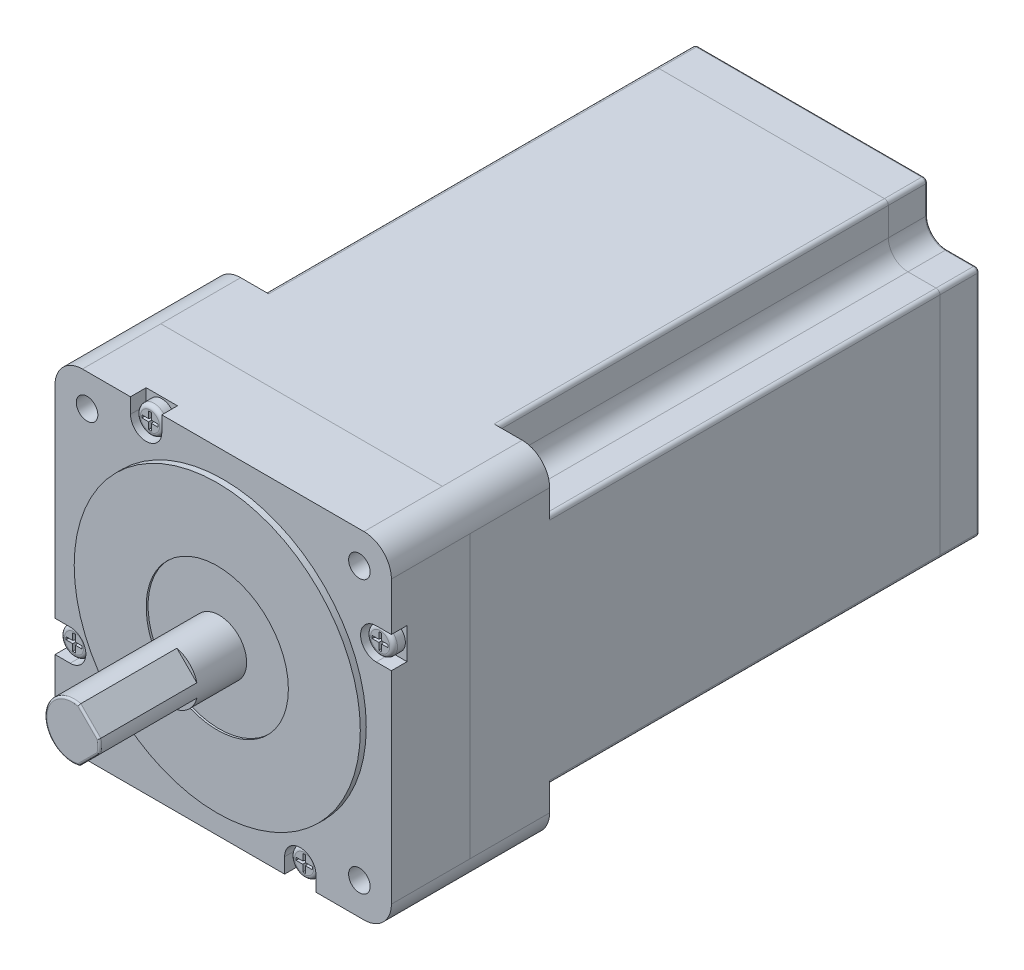
from build123d import *
from OCP.BRepFilletAPI import BRepFilletAPI_MakeChamfer

# Parameters (mm, degrees)
SKETCH1_R                = 2.75
BOSS_EXTRUDE1_DEPTH      = 150
SKETCH2_R                = 36.51
BOSS_EXTRUDE2_DEPTH      = 1.52
BOSS_EXTRUDE3_DEPTH      = 37
BOSS_EXTRUDE3_DEPTH_BACK = 1
SKETCH3_R                = 7
CUT_EXTRUDE1_DEPTH       = 25
FILLET1_R                = 0.5
SKETCH5_R                = 18.150459798
CUT_EXTRUDE2_DEPTH       = 0.5
CUT_EXTRUDE3_DEPTH       = 109.62
FILLET2_R                = 0.5
FILLET3_R                = 1
SKETCH8_R                = 10
CUT_EXTRUDE4_DEPTH       = 1
SKETCH9_R                = 6
BOSS_EXTRUDE4_DEPTH      = 0.8
CUT_EXTRUDE5_DEPTH       = 4
SKETCH11_R               = 3.434192677
BOSS_EXTRUDE5_DEPTH      = 3
FILLET4_R                = 1
CUT_EXTRUDE6_DEPTH       = 2
CUT_EXTRUDE6_DRAFT       = -6
CHAMFER2_SIZE            = 1.5
CHAMFER2_SIZE2           = 1.685405696
CIRPATTERN3_COUNT        = 4


with BuildPart() as part:
    # Sketch1 → Boss-Extrude1 (new body)
    with BuildSketch(Plane.XY):
        with BuildLine():
            Line((-35.925, -42.925), (35.925, -42.925))
            ThreePointArc((35.925, -42.925), (40.874747468, -40.874747468), (42.925, -35.925))
            Line((42.925, -35.925), (42.925, 35.925))
            ThreePointArc((42.925, 35.925), (40.874747468, 40.874747468), (35.925, 42.925))
            Line((35.925, 42.925), (-35.925, 42.925))
            ThreePointArc((-35.925, 42.925), (-40.874747468, 40.874747468), (-42.925, 35.925))
            Line((-42.925, 35.925), (-42.925, -35.925))
            ThreePointArc((-42.925, -35.925), (-40.874747468, -40.874747468), (-35.925, -42.925))
        make_face()
        with Locations((-34.75, 34.75)):
            Circle(SKETCH1_R, mode=Mode.SUBTRACT)
        with Locations((34.75, 34.75)):
            Circle(SKETCH1_R, mode=Mode.SUBTRACT)
        with Locations((-34.75, -34.75)):
            Circle(SKETCH1_R, mode=Mode.SUBTRACT)
        with Locations((34.75, -34.75)):
            Circle(SKETCH1_R, mode=Mode.SUBTRACT)
    extrude(amount=BOSS_EXTRUDE1_DEPTH)

    # Sketch2 → Boss-Extrude2 (add)
    with BuildSketch(Plane.XY.offset(150)):
        Circle(SKETCH2_R)
    extrude(amount=BOSS_EXTRUDE2_DEPTH)

    # Sketch5 → Cut-Extrude2 (cut)
    with BuildSketch(Plane.XY.offset(151.52)):
        Circle(SKETCH5_R)
    extrude(amount=-CUT_EXTRUDE2_DEPTH, mode=Mode.SUBTRACT)

    # Sketch6 → Cut-Extrude3 (cut)
    with BuildSketch(Plane(origin=(0, 0, 0), x_dir=(-1, 0, 0), z_dir=(0, 0, -1))):
        with BuildLine():
            Line((-29.75, 34.75), (-29.75, 42.925))
            Line((-29.75, 42.925), (-35.925, 42.925))
            ThreePointArc((-35.925, 42.925), (-40.874747468, 40.874747468), (-42.925, 35.925))
            Line((-42.925, 35.925), (-42.925, 29.75))
            Line((-42.925, 29.75), (-34.75, 29.75))
            ThreePointArc((-34.75, 29.75), (-31.214466094, 31.214466094), (-29.75, 34.75))
        make_face()
        with BuildLine():
            Line((35.925, 42.925), (29.75, 42.925))
            Line((29.75, 42.925), (29.75, 34.75))
            ThreePointArc((29.75, 34.75), (31.214466094, 31.214466094), (34.75, 29.75))
            Line((34.75, 29.75), (42.925, 29.75))
            Line((42.925, 29.75), (42.925, 35.925))
            ThreePointArc((42.925, 35.925), (40.874747468, 40.874747468), (35.925, 42.925))
        make_face()
        with BuildLine():
            Line((29.75, -34.75), (29.75, -42.925))
            Line((29.75, -42.925), (35.925, -42.925))
            ThreePointArc((35.925, -42.925), (40.874747468, -40.874747468), (42.925, -35.925))
            Line((42.925, -35.925), (42.925, -29.75))
            Line((42.925, -29.75), (34.75, -29.75))
            ThreePointArc((34.75, -29.75), (31.214466094, -31.214466094), (29.75, -34.75))
        make_face()
        with BuildLine():
            Line((-35.925, -42.925), (-29.75, -42.925))
            Line((-29.75, -42.925), (-29.75, -34.75))
            ThreePointArc((-29.75, -34.75), (-31.214466094, -31.214466094), (-34.75, -29.75))
            Line((-34.75, -29.75), (-42.925, -29.75))
            Line((-42.925, -29.75), (-42.925, -35.925))
            ThreePointArc((-42.925, -35.925), (-40.874747468, -40.874747468), (-35.925, -42.925))
        make_face()
    extrude(amount=-CUT_EXTRUDE3_DEPTH, mode=Mode.SUBTRACT)

    # Fillet2
    fillet2_edges = [part.edges().sort_by_distance(p)[0] for p in [
        (42.925, 0, 0),
        (29.75, -38.8375, 0),
        (31.214466094, -31.214466094, 0),
        (38.8375, -29.75, 0),
        (0, 42.925, 0),
        (31.214466094, 31.214466094, 0),
        (29.75, 38.8375, 0),
        (38.8375, 29.75, 0),
        (-42.925, 0, 0),
        (-29.75, 38.8375, 0),
        (-31.214466094, 31.214466094, 0),
        (-38.8375, 29.75, 0),
        (0, -42.925, 0),
        (-31.214466094, -31.214466094, 0),
        (-29.75, -38.8375, 0),
        (-38.8375, -29.75, 0),
    ]]
    fillet(fillet2_edges, radius=FILLET2_R)

    # Fillet3
    # the kernel refuses this fillet: 1 mm, written as the material it takes off along each edge
    with BuildSketch(Plane(origin=(-41.925, -28.75, 0), x_dir=(0, -1, 0), z_dir=(1, 0, 0))) as fillet3_piece_1:
        with BuildLine():
            CenterArc((0.5, -0.5), 0.5, 0, 90)
            Line((1, -0.5), (1, 0))
            Line((1, 0), (0.5, 0))
        make_face()
    revolve(axis=Axis((-41.925, -28.75, 0), (0, 0, -1)), revolution_arc=90, mode=Mode.SUBTRACT)
    with BuildSketch(Plane(origin=(-41.925, 28.75, 0), x_dir=(-1, 0, 0), z_dir=(0, -1, 0))) as fillet3_piece_2:
        with BuildLine():
            CenterArc((0.5, -0.5), 0.5, 0, 90)
            Line((1, -0.5), (1, 0))
            Line((1, 0), (0.5, 0))
        make_face()
    revolve(axis=Axis((-41.925, 28.75, 0), (0, 0, -1)), revolution_arc=90, mode=Mode.SUBTRACT)
    with BuildSketch(Plane(origin=(-28.75, -41.925, 0), x_dir=(0, -1, 0), z_dir=(1, 0, 0))) as fillet3_piece_3:
        with BuildLine():
            CenterArc((0.5, -0.5), 0.5, 0, 90)
            Line((1, -0.5), (1, 0))
            Line((1, 0), (0.5, 0))
        make_face()
    revolve(axis=Axis((-28.75, -41.925, 0), (0, 0, -1)), revolution_arc=90, mode=Mode.SUBTRACT)
    with BuildSketch(Plane(origin=(28.75, -41.925, 0), x_dir=(1, 0, 0), z_dir=(0, 1, 0))) as fillet3_piece_4:
        with BuildLine():
            CenterArc((0.5, -0.5), 0.5, 0, 90)
            Line((1, -0.5), (1, 0))
            Line((1, 0), (0.5, 0))
        make_face()
    revolve(axis=Axis((28.75, -41.925, 0), (0, 0, -1)), revolution_arc=90, mode=Mode.SUBTRACT)
    with BuildSketch(Plane(origin=(-28.75, 41.925, 0), x_dir=(-1, 0, 0), z_dir=(0, -1, 0))) as fillet3_piece_5:
        with BuildLine():
            CenterArc((0.5, -0.5), 0.5, 0, 90)
            Line((1, -0.5), (1, 0))
            Line((1, 0), (0.5, 0))
        make_face()
    revolve(axis=Axis((-28.75, 41.925, 0), (0, 0, -1)), revolution_arc=90, mode=Mode.SUBTRACT)
    with BuildSketch(Plane(origin=(28.75, 41.925, 0), x_dir=(0, 1, 0), z_dir=(-1, 0, 0))) as fillet3_piece_6:
        with BuildLine():
            CenterArc((0.5, -0.5), 0.5, 0, 90)
            Line((1, -0.5), (1, 0))
            Line((1, 0), (0.5, 0))
        make_face()
    revolve(axis=Axis((28.75, 41.925, 0), (0, 0, -1)), revolution_arc=90, mode=Mode.SUBTRACT)
    with BuildSketch(Plane(origin=(41.925, -28.75, 0), x_dir=(1, 0, 0), z_dir=(0, 1, 0))) as fillet3_piece_7:
        with BuildLine():
            CenterArc((0.5, -0.5), 0.5, 0, 90)
            Line((1, -0.5), (1, 0))
            Line((1, 0), (0.5, 0))
        make_face()
    revolve(axis=Axis((41.925, -28.75, 0), (0, 0, -1)), revolution_arc=90, mode=Mode.SUBTRACT)
    with BuildSketch(Plane(origin=(41.925, 28.75, 0), x_dir=(0, 1, 0), z_dir=(-1, 0, 0))) as fillet3_piece_8:
        with BuildLine():
            CenterArc((0.5, -0.5), 0.5, 0, 90)
            Line((1, -0.5), (1, 0))
            Line((1, 0), (0.5, 0))
        make_face()
    revolve(axis=Axis((41.925, 28.75, 0), (0, 0, -1)), revolution_arc=90, mode=Mode.SUBTRACT)
    with BuildSketch(Plane(origin=(42.925, -29.75, 0), x_dir=(0, 1, 0), z_dir=(0, 0, 1)), Plane(origin=(-29.75, -42.925, 0), x_dir=(1, 0, 0), z_dir=(0, 0, 1)), Plane(origin=(-42.925, -29.75, 0), x_dir=(1, 0, 0), z_dir=(0, 0, 1)), Plane(origin=(-42.925, 29.75, 0), x_dir=(0, -1, 0), z_dir=(0, 0, 1)), Plane(origin=(29.75, 42.925, 0), x_dir=(-1, 0, 0), z_dir=(0, 0, 1))) as fillet3_piece_9:
        with BuildLine():
            CenterArc((FILLET3_R, FILLET3_R), FILLET3_R, 180, 90)
            Line((0, FILLET3_R), (0, 0))
            Line((0, 0), (FILLET3_R, 0))
        make_face()
    extrude(amount=109.62, mode=Mode.SUBTRACT)
    with BuildSketch(Plane(origin=(29.75, -42.925, 0), x_dir=(-1, 0, 0), z_dir=(0, 0, 1)), Plane(origin=(-29.75, 42.925, 0), x_dir=(1, 0, 0), z_dir=(0, 0, 1)), Plane(origin=(42.925, 29.75, 0), x_dir=(0, -1, 0), z_dir=(0, 0, 1))) as fillet3_piece_10:
        with BuildLine():
            CenterArc((FILLET3_R, -FILLET3_R), FILLET3_R, 90, 90)
            Line((0, -FILLET3_R), (0, 0))
            Line((0, 0), (FILLET3_R, 0))
        make_face()
    extrude(amount=109.62, mode=Mode.SUBTRACT)

    # Sketch8 → Cut-Extrude4 (cut)
    with BuildSketch(Plane(origin=(0, 0, 0), x_dir=(-1, 0, 0), z_dir=(0, 0, -1))):
        Circle(SKETCH8_R)
    extrude(amount=-CUT_EXTRUDE4_DEPTH, mode=Mode.SUBTRACT)

    # Sketch10 → Cut-Extrude5 (cut)
    with BuildSketch(Plane.XY.offset(150)):
        with BuildLine():
            Line((-23.668230311, 39.056860772), (-23.668230311, 42.925))
            Line((-23.668230311, 42.925), (-15.668230311, 42.925))
            Line((-15.668230311, 42.925), (-15.668230311, 39.056860772))
            ThreePointArc((-15.668230311, 39.056860772), (-19.668230311, 35.056860772), (-23.668230311, 39.056860772))
        make_face()
        with BuildLine():
            Line((39.056860772, 23.668230311), (42.925, 23.668230311))
            Line((42.925, 23.668230311), (42.925, 15.668230311))
            Line((42.925, 15.668230311), (39.056860772, 15.668230311))
            ThreePointArc((39.056860772, 15.668230311), (35.056860772, 19.668230311), (39.056860772, 23.668230311))
        make_face()
        with BuildLine():
            Line((23.668230311, -39.056860772), (23.668230311, -42.925))
            Line((23.668230311, -42.925), (15.668230311, -42.925))
            Line((15.668230311, -42.925), (15.668230311, -39.056860772))
            ThreePointArc((15.668230311, -39.056860772), (19.668230311, -35.056860772), (23.668230311, -39.056860772))
        make_face()
        with BuildLine():
            Line((-39.056860772, -23.668230311), (-42.925, -23.668230311))
            Line((-42.925, -23.668230311), (-42.925, -15.668230311))
            Line((-42.925, -15.668230311), (-39.056860772, -15.668230311))
            ThreePointArc((-39.056860772, -15.668230311), (-35.056860772, -19.668230311), (-39.056860772, -23.668230311))
        make_face()
    extrude(amount=-CUT_EXTRUDE5_DEPTH, mode=Mode.SUBTRACT)


with BuildPart() as body_2:
    # Sketch3 → Boss-Extrude3 (new, two sides: drawn at the far end of the back side and taken through both)
    with BuildSketch(Plane.XY.offset(151.52).offset(-BOSS_EXTRUDE3_DEPTH_BACK)):
        Circle(SKETCH3_R)
    extrude(amount=BOSS_EXTRUDE3_DEPTH + BOSS_EXTRUDE3_DEPTH_BACK)

    # Sketch4 → Cut-Extrude1 (cut)
    with BuildSketch(Plane.XY.offset(188.52)):
        with BuildLine():
            Line((1.69313093, 6.792150444), (6.792150444, 1.69313093))
            ThreePointArc((6.792150444, 1.69313093), (4.949747468, 4.949747468), (1.69313093, 6.792150444))
        make_face()
        with BuildLine():
            Line((1.69313093, -6.792150444), (6.792150444, -1.69313093))
            ThreePointArc((6.792150444, -1.69313093), (4.949747468, -4.949747468), (1.69313093, -6.792150444))
        make_face()
    extrude(amount=-CUT_EXTRUDE1_DEPTH, mode=Mode.SUBTRACT)

    # Fillet1
    fillet1_edges = [body_2.edges().sort_by_distance(p)[0] for p in [
        (4.242640687, 4.242640687, 188.52),
        (6.947843302, 0.852920539, 188.52),
        (4.242640687, -4.242640687, 188.52),
        (-7, 0, 188.52),
    ]]
    fillet(fillet1_edges, radius=FILLET1_R)


with BuildPart() as body_3:
    # Sketch9 → Boss-Extrude4 (new body)
    with BuildSketch(Plane(origin=(0, 0, 1), x_dir=(-1, 0, 0), z_dir=(0, 0, -1))):
        Circle(SKETCH9_R)
    extrude(amount=BOSS_EXTRUDE4_DEPTH)


with BuildPart() as body_4:
    # Sketch11 → Boss-Extrude5 (new body)
    with BuildSketch(Plane.XY.offset(146)):
        with Locations((-19.668230311, 39.056860772)):
            Circle(SKETCH11_R)
    extrude(amount=BOSS_EXTRUDE5_DEPTH)

    # Fillet4
    fillet4_edges = [body_4.edges().sort_by_distance(p)[0] for p in [
        (-23.102422989, 39.056860772, 149),
    ]]
    fillet(fillet4_edges, radius=FILLET4_R)


with BuildPart() as cut_extrude6_tool:
    # Sketch12 → Cut-Extrude6 (with draft: the straight prism first)
    with BuildSketch(Plane.XY.offset(149)):
        Polygon((-19.317907501, 39.406818019), (-19.317907501, 41.116130582), (-20.018553122, 41.116130582), (-20.018553122, 39.406818019), (-21.725351266, 39.406818019), (-21.725351266, 38.706903524), (-20.018553122, 38.706903524), (-20.018553122, 36.997590961), (-19.317907501, 36.997590961), (-19.317907501, 38.706903524), (-17.611109357, 38.706903524), (-17.611109357, 39.406818019), align=None)
    extrude(amount=-CUT_EXTRUDE6_DEPTH)
    # Cut-Extrude6: the draft: its side faces are tilted about the plane it starts from
    cut_extrude6_sides = [cut_extrude6_tool.faces().sort_by_distance(p)[0] for p in [
        (-19.317907501, 40.261474301, 148),
        (-19.668230311, 41.116130582, 148),
        (-20.018553122, 40.261474301, 148),
        (-20.871952194, 39.406818019, 148),
        (-21.725351266, 39.056860772, 148),
        (-20.871952194, 38.706903524, 148),
        (-20.018553122, 37.852247243, 148),
        (-19.668230311, 36.997590961, 148),
        (-19.317907501, 37.852247243, 148),
        (-18.464508429, 38.706903524, 148),
        (-17.611109357, 39.056860772, 148),
        (-18.464508429, 39.406818019, 148),
    ]]
    draft(cut_extrude6_sides, Plane.XY.offset(149), CUT_EXTRUDE6_DRAFT)


with BuildPart() as body_4_1:
    add(body_4.part)

    # Cut-Extrude6: cut by cut_extrude6_tool
    add(cut_extrude6_tool.part, mode=Mode.SUBTRACT)

    # Chamfer2: one chamfer whose edges measure the first distance from different faces: ONE call of the kernel's chamfer builder (chamfer() names one face for all edges)
    chamfer2_edges_1 = [body_4_1.edges().sort_by_distance(p)[0] for p in [
        (-17.821317827, 39.056860772, 147),
    ]]
    chamfer2_side_1 = [body_4_1.faces().sort_by_distance(p)[0] for p in [
        (-17.701174773, 39.056860772, 148.143084803),
    ]]
    chamfer2_edges_2 = [body_4_1.edges().sort_by_distance(p)[0] for p in [
        (-19.668230311, 37.207799432, 147),
    ]]
    chamfer2_side_2 = [body_4_1.faces().sort_by_distance(p)[0] for p in [
        (-19.668230311, 37.087678797, 148.142871497),
    ]]
    chamfer2_edges_3 = [body_4_1.edges().sort_by_distance(p)[0] for p in [
        (-21.515142796, 39.056860772, 147),
    ]]
    chamfer2_side_3 = [body_4_1.faces().sort_by_distance(p)[0] for p in [
        (-21.63528585, 39.056860772, 148.143084803),
    ]]
    chamfer2_edges_4 = [body_4_1.edges().sort_by_distance(p)[0] for p in [
        (-19.668230311, 40.905922111, 147),
    ]]
    chamfer2_side_4 = [body_4_1.faces().sort_by_distance(p)[0] for p in [
        (-19.668230311, 41.026042746, 148.142871497),
    ]]
    chamfer2 = BRepFilletAPI_MakeChamfer(body_4_1.part.solid().wrapped)
    for e in chamfer2_edges_1:
        chamfer2.Add(CHAMFER2_SIZE, CHAMFER2_SIZE2, e.wrapped, chamfer2_side_1[0].wrapped)  # the first distance lies on this face
    for e in chamfer2_edges_2:
        chamfer2.Add(CHAMFER2_SIZE, CHAMFER2_SIZE2, e.wrapped, chamfer2_side_2[0].wrapped)  # the first distance lies on this face
    for e in chamfer2_edges_3:
        chamfer2.Add(CHAMFER2_SIZE, CHAMFER2_SIZE2, e.wrapped, chamfer2_side_3[0].wrapped)  # the first distance lies on this face
    for e in chamfer2_edges_4:
        chamfer2.Add(CHAMFER2_SIZE, CHAMFER2_SIZE2, e.wrapped, chamfer2_side_4[0].wrapped)  # the first distance lies on this face
    add(Compound.cast(chamfer2.Shape()), mode=Mode.REPLACE)


with BuildPart() as cirpattern3_1:
    # CirPattern3: pattern copy
    add(body_4_1.part.rotate(Axis((0, 0, 0), (0, 0, 1)), 1 * 360 / CIRPATTERN3_COUNT))


with BuildPart() as cirpattern3_2:
    # CirPattern3: pattern copy
    add(body_4_1.part.rotate(Axis((0, 0, 0), (0, 0, 1)), 2 * 360 / CIRPATTERN3_COUNT))


with BuildPart() as cirpattern3_3:
    # CirPattern3: pattern copy
    add(body_4_1.part.rotate(Axis((0, 0, 0), (0, 0, 1)), 3 * 360 / CIRPATTERN3_COUNT))


solid = Compound([part.part, body_2.part, body_3.part, body_4_1.part, cirpattern3_1.part, cirpattern3_2.part, cirpattern3_3.part])
